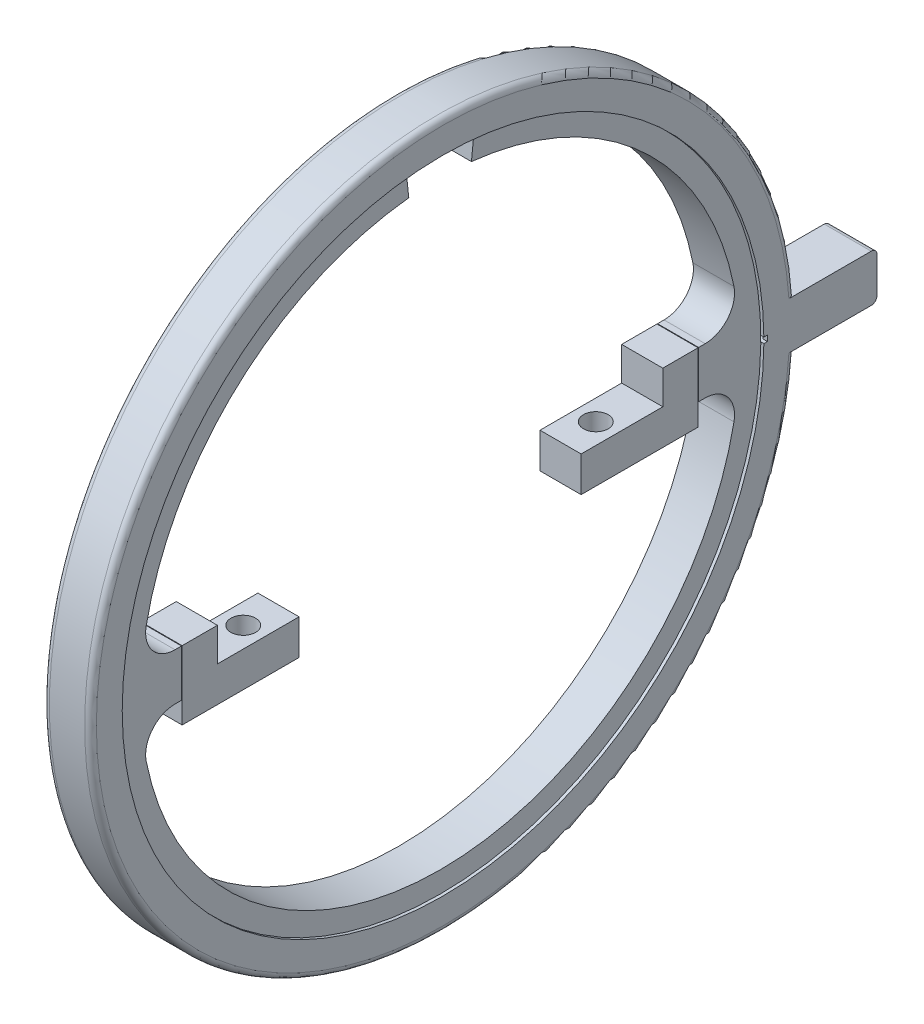
from build123d import *

# Parameters (mm, degrees)
REVOLVE2_ANGLE      = 174
BOSS_EXTRUDE3_DEPTH = 1.75
SKETCH9_R           = 0.79375
CUT_EXTRUDE2_DEPTH  = 2.5
BOSS_EXTRUDE5_DEPTH = 1.75
SKETCH14_R          = 1.05
CUT_EXTRUDE4_DEPTH  = 3
FILLET5_R           = 2.5
SKETCH5_W           = 7
SKETCH5_H           = 4
BOSS_EXTRUDE2_DEPTH = 2
CUT_REVOLVE1_ANGLE  = 1
FILLET3_R           = 0.5
FILLET4_R           = 0.5


# Read off the part's stored shape, not the designer's step: Revolve2
with BuildPart() as part:
    # Sketch2 → Revolve1 (revolve)
    with BuildSketch(Plane(origin=(0, 0, 0), x_dir=(1, 0, 0), z_dir=(0, 1, 0)), mode=Mode.PRIVATE) as revolve1_sk:
        Polygon((-0.5, 28.5), (0, 28.5), (0, 30), (-2, 30), (-2, 27.3), (-1.506919557, 27.3), align=None)
    revolve1 = revolve(revolve1_sk.sketch.rotate(Axis((0, 0, 0), (1, 0, 0)), 180), axis=Axis((0, 0, 0), (1, 0, 0)))


with BuildPart() as body_2:
    # Revolve2 outline → Revolve2 (revolve)
    with BuildSketch(Plane(origin=(0, 0, 0), x_dir=(0, -1, 0), z_dir=(0, 0, 1))):
        Polygon((25.5, 0), (25.5, -1.75), (27.29, -1.75), (27.29, -1.502256481), (28.491219063, -0.494314008), (28.491219063, 0), align=None)
    revolve2 = revolve(axis=Axis((0, 0, 0), (1, 0, 0)), revolution_arc=REVOLVE2_ANGLE)


with BuildPart() as part_1:
    add(part.part)

    add(body_2.part)  # Mirror1 merges body 2
    # Mirror1: Revolve1, Revolve2 across plane
    add(revolve1.mirror(Plane(origin=(0, 0, 0), x_dir=(0, 0, 1), z_dir=(1, 0, 0))))
    add(revolve2.mirror(Plane(origin=(0, 0, 0), x_dir=(0, 0, 1), z_dir=(1, 0, 0))))

    # Sketch8 → Boss-Extrude3 (add, symmetric)
    with BuildSketch(Plane(origin=(0, 0, 0), x_dir=(0, 0, -1), z_dir=(1, 0, 0))):
        with BuildLine():
            Line((25.421447638, 2), (22, 2))
            Line((22, 2), (22, -2))
            Line((22, -2), (25.421447638, -2))
            ThreePointArc((25.421447638, -2), (25.5, 0), (25.421447638, 2))
        make_face()
    extrude(amount=BOSS_EXTRUDE3_DEPTH, both=True)

    # Sketch9 → Cut-Extrude2 (cut)
    with BuildSketch(Plane.XY.offset(-22)):
        Circle(SKETCH9_R)
    extrude(amount=-CUT_EXTRUDE2_DEPTH, mode=Mode.SUBTRACT)

    # Fillet5
    fillet5_edges = [part_1.edges().sort_by_distance(p)[0] for p in [
        (0, -2, -25.421447638),
        (0, 2, -25.421447638),
    ]]
    fillet(fillet5_edges, radius=FILLET5_R)

    # Mirror2: part across plane


with BuildPart() as body_2_2:
    # Sketch13 → Boss-Extrude5 (new, symmetric)
    with BuildSketch(Plane(origin=(0, 0, 0), x_dir=(0, 0, -1), z_dir=(1, 0, 0))):
        Polygon((21.95, 2), (18.95, 2), (18.95, -0.85), (12, -0.85), (12, -3.85), (21.95, -3.85), align=None)
    extrude(amount=BOSS_EXTRUDE5_DEPTH, both=True)

    # Sketch14 → Cut-Extrude4 (cut)
    with BuildSketch(Plane(origin=(0, -0.85, 0), x_dir=(1, 0, 0), z_dir=(0, 1, 0))):
        with Locations(Location((0, 15, 0), (0, 0, 270))):
            Circle(SKETCH14_R)
    extrude(amount=-CUT_EXTRUDE4_DEPTH, mode=Mode.SUBTRACT)


with BuildPart() as part_2:
    add(part_1.part)
    add(part_1.part.mirror(Plane.XY))

    # Sketch5 → Boss-Extrude2 (add, symmetric)
    with BuildSketch(Plane(origin=(0, 0, 0), x_dir=(0, 0, -1), z_dir=(1, 0, 0))):
        with Locations((33.433259094, 0)):
            Rectangle(SKETCH5_W, SKETCH5_H)
    extrude(amount=BOSS_EXTRUDE2_DEPTH, both=True)

    # Sketch6 → Cut-Revolve1 (revolve, symmetric, cut)
    with BuildSketch(Plane(origin=(0, 0, 0), x_dir=(1, 0, 0), z_dir=(0, 1, 0))) as cut_revolve1_sk:
        Polygon((-2, 27.6), (-2, 27.3), (-1.506919557, 27.3), (-0.5, 28.5), (0, 28.5), (0, 28.8), (-0.639892297, 28.8), (-1.646811855, 27.6), align=None)
    cut_revolve1 = revolve(axis=Axis((0, 0, 0), (1, 0, 0)), revolution_arc=CUT_REVOLVE1_ANGLE / 2, mode=Mode.SUBTRACT)
    cut_revolve1 = cut_revolve1 + revolve(cut_revolve1_sk.sketch, axis=Axis((0, 0, 0), (-1, 0, 0)), revolution_arc=CUT_REVOLVE1_ANGLE / 2, mode=Mode.SUBTRACT)

    # Mirror3: Cut-Revolve1 across plane
    add(cut_revolve1.mirror(Plane(origin=(0, 0, 0), x_dir=(0, 0, 1), z_dir=(1, 0, 0))), mode=Mode.SUBTRACT)

    # Fillet3
    fillet3_edges = [part_2.edges().sort_by_distance(p)[0] for p in [
        (0, 2, -36.933259094),
        (0, -2, -36.933259094),
    ]]
    fillet(fillet3_edges, radius=FILLET3_R)

    # Fillet4
    fillet4_edges = [part_2.edges().sort_by_distance(p)[0] for p in [
        (2, -29.983310131, 1.000556639),
        (-2, -29.983310131, 1.000556639),
    ]]
    fillet(fillet4_edges, radius=FILLET4_R)


with BuildPart() as body_3:
    # Mirror6: mirrored copy
    add(body_2_2.part.mirror(Plane.XY))


solid = Compound([body_2_2.part, part_2.part, body_3.part])
